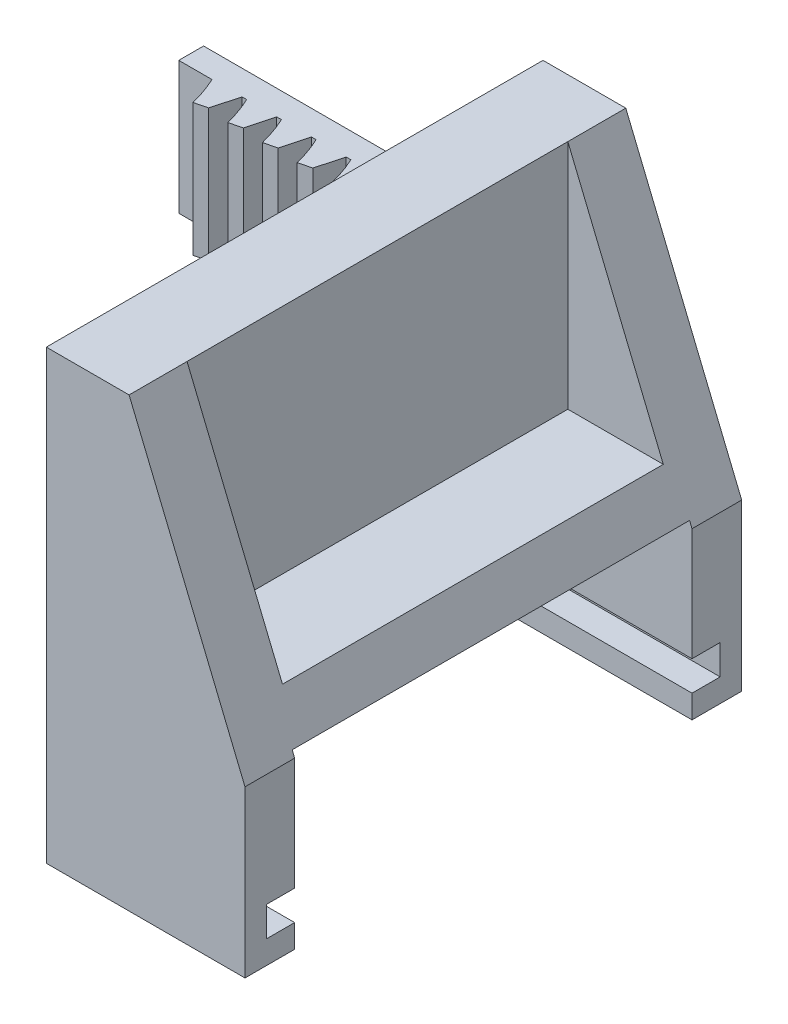
from build123d import *

# Parameters (mm, degrees)
BOSS_EXTRUDE1_DEPTH = 30
SKETCH4_W           = 24
SKETCH4_H           = 12
CUT_EXTRUDE2_DEPTH  = 25
SKETCH5_W           = 1.7
SKETCH5_H           = 1.8
CUT_EXTRUDE3_DEPTH  = 15
CUT_EXTRUDE4_DEPTH  = 11.5
BOSS_EXTRUDE2_DEPTH = 8


with BuildPart() as part:
    # Sketch1 → Boss-Extrude1 (new body)
    with BuildSketch(Plane.XY):
        Polygon((0, 0), (0, -27), (12, -27), (12, -17), (5, 0), align=None)
    extrude(amount=-BOSS_EXTRUDE1_DEPTH)

    # Sketch4 → Cut-Extrude2 (cut)
    with BuildSketch(Plane.ZY):
        with Locations((-15, -22.638599401)):
            Rectangle(SKETCH4_W, SKETCH4_H)
    extrude(amount=-CUT_EXTRUDE2_DEPTH, mode=Mode.SUBTRACT)

    # Sketch5 → Cut-Extrude3 (cut)
    with BuildSketch(Plane.ZY):
        with Locations((-2.15, -24.7)):
            Rectangle(SKETCH5_W, SKETCH5_H)
    cut_extrude3 = extrude(amount=-CUT_EXTRUDE3_DEPTH, mode=Mode.SUBTRACT)

    # Mirror1: Cut-Extrude3 across plane
    add(cut_extrude3.mirror(Plane.XY.offset(-15)), mode=Mode.SUBTRACT)

    # Sketch6 → Cut-Extrude4 (cut, symmetric)
    with BuildSketch(Plane.XY.offset(-15)):
        Polygon((5, 0), (5, -14), (10.764705882, -14), align=None)
    extrude(amount=CUT_EXTRUDE4_DEPTH, both=True, mode=Mode.SUBTRACT)

    # Sketch7 → Boss-Extrude2 (add)
    with BuildSketch(Plane(origin=(0, -16, 0), x_dir=(1, 0, 0), z_dir=(0, 1, 0))):
        with BuildLine():
            Line((0, 28.5), (-19, 28.5))
            Line((-19, 28.5), (-19, 27))
            Line((-19, 27), (-16.993455994, 27))
            ThreePointArc((-16.993455994, 27), (-16.636279679, 26.129093684), (-16.365476207, 25.227584833))
            Line((-16.365476207, 25.227584833), (-15.609396851, 25.415112691))
            Line((-15.609396851, 25.415112691), (-15.179008189, 27))
            Line((-15.179008189, 27), (-14.896454824, 27))
            ThreePointArc((-14.896454824, 27), (-14.539278509, 26.129093684), (-14.268475038, 25.227584833))
            Line((-14.268475038, 25.227584833), (-13.512395681, 25.415112691))
            Line((-13.512395681, 25.415112691), (-13.082007019, 27))
            Line((-13.082007019, 27), (-12.799453654, 27))
            ThreePointArc((-12.799453654, 27), (-12.442277339, 26.129093684), (-12.171473868, 25.227584833))
            Line((-12.171473868, 25.227584833), (-11.415394512, 25.415112691))
            Line((-11.415394512, 25.415112691), (-10.985005849, 27))
            Line((-10.985005849, 27), (-10.702452484, 27))
            ThreePointArc((-10.702452484, 27), (-10.34527617, 26.129093684), (-10.074472698, 25.227584833))
            Line((-10.074472698, 25.227584833), (-9.318393342, 25.415112691))
            Line((-9.318393342, 25.415112691), (-8.888004679, 27))
            Line((-8.888004679, 27), (-8.605451315, 27))
            ThreePointArc((-8.605451315, 27), (-8.248275, 26.129093684), (-7.977471528, 25.227584833))
            Line((-7.977471528, 25.227584833), (-7.221392172, 25.415112691))
            Line((-7.221392172, 25.415112691), (-6.791003509, 27))
            Line((-6.791003509, 27), (-6.508450145, 27))
            ThreePointArc((-6.508450145, 27), (-6.15127383, 26.129093684), (-5.880470358, 25.227584833))
            Line((-5.880470358, 25.227584833), (-5.124391002, 25.415112691))
            Line((-5.124391002, 25.415112691), (-4.69400234, 27))
            Line((-4.69400234, 27), (-4.411448975, 27))
            ThreePointArc((-4.411448975, 27), (-4.05427266, 26.129093684), (-3.783469189, 25.227584833))
            Line((-3.783469189, 25.227584833), (-3.027389832, 25.415112691))
            Line((-3.027389832, 25.415112691), (-2.59700117, 27))
            Line((-2.59700117, 27), (-2.314447805, 27))
            ThreePointArc((-2.314447805, 27), (-1.95727149, 26.129093684), (-1.686468019, 25.227584833))
            Line((-1.686468019, 25.227584833), (-0.930388662, 25.415112691))
            Line((-0.930388662, 25.415112691), (-0.5, 27))
            Line((-0.5, 27), (0, 27))
            Line((0, 27), (0, 28.5))
        make_face()
    extrude(amount=BOSS_EXTRUDE2_DEPTH)


solid = part.part
